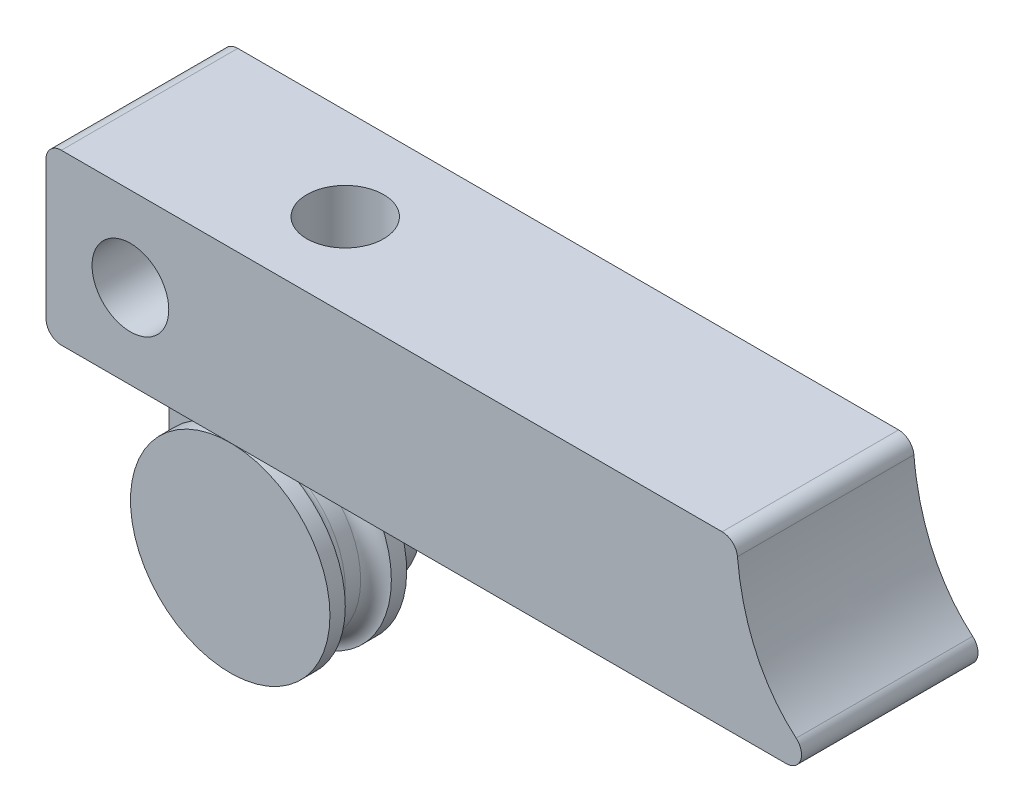
from build123d import *

# Parameters (mm, degrees)
BOSS_EXTRUDE1_DEPTH = 3.5
BOSS_EXTRUDE2_DEPTH = 8
FILLET1_R           = 1
SKETCH3_R           = 1.5
CUT_EXTRUDE1_DEPTH  = 8
SKETCH4_R           = 2.5
CUT_EXTRUDE2_DEPTH  = 5
CUT_EXTRUDE3_REACH  = 58.527
SKETCH5_R           = 1.5
SKETCH6_R           = 2.5
CUT_EXTRUDE4_DEPTH  = 5
CUT_EXTRUDE5_REACH  = 57.139
SKETCH7_R           = 1.5
SKETCH8_R           = 6.5
BOSS_EXTRUDE3_DEPTH = 5
CUT_EXTRUDE6_START  = -4
SKETCH9_R           = 6.5
SKETCH9_R_2         = 5.5
CUT_EXTRUDE6_DEPTH  = 3
FILLET2_R           = 1


with BuildPart() as part:
    # Sketch1 → Boss-Extrude1 (new body)
    with BuildSketch(Plane.XY):
        with BuildLine():
            Line((0, 0), (45, 0))
            add(Edge.make_bspline(
                [(45, 0), (45.167594828, -4.342902355), (46.894946491, -9.232868563), (52, -11)],
                knots=[0, 0, 0, 0, 1, 1, 1, 1], degree=3))
            Line((52, -11), (13, -11))
            Line((13, -11), (13, -20.5))
            ThreePointArc((13, -20.5), (6.5, -27), (0, -20.5))
            Line((0, -20.5), (0, 0))
        make_face()
    extrude(amount=BOSS_EXTRUDE1_DEPTH)

    # Sketch2 → Boss-Extrude2 (add)
    with BuildSketch(Plane.XY.offset(3.5)):
        with BuildLine():
            Line((0, 0), (0, -11))
            Line((0, -11), (13, -11))
            Line((13, -11), (52, -11))
            add(Edge.make_bspline(
                [(52, -11), (46.894946491, -9.232868563), (45.167594828, -4.342902355), (45, 0)],
                knots=[0, 0, 0, 0, 1, 1, 1, 1], degree=3))
            Line((45, 0), (0, 0))
        make_face()
    extrude(amount=BOSS_EXTRUDE2_DEPTH)

    # Fillet1
    fillet1_edges = [part.edges().sort_by_distance(p)[0] for p in [
        (52, -11, 7.5),
        (45, 0, 7.5),
        (0, 0, 5.75),
        (0, -11, 7.5),
    ]]
    fillet(fillet1_edges, radius=FILLET1_R)

    # Sketch3 → Cut-Extrude1 (cut)
    with BuildSketch(Plane.XY.offset(3.5)):
        with Locations((9.004616649, -20.5)):
            Circle(SKETCH3_R)
    extrude(amount=-CUT_EXTRUDE1_DEPTH, mode=Mode.SUBTRACT)

    # Sketch4 → Cut-Extrude2 (cut)
    with BuildSketch(Plane.XY.offset(11.5)):
        with Locations((5.5, -5.5)):
            Circle(SKETCH4_R)
    extrude(amount=-CUT_EXTRUDE2_DEPTH, mode=Mode.SUBTRACT)

    # Sketch5 → Cut-Extrude3 (cut, up to next)
    with BuildSketch(Plane.XY.offset(6.5), mode=Mode.PRIVATE) as cut_extrude3_sk1:
        with Locations((5.5, -5.5)):
            Circle(SKETCH5_R)
    cut_extrude3_tool1 = extrude(cut_extrude3_sk1.sketch, amount=-CUT_EXTRUDE3_REACH, mode=Mode.PRIVATE) & part.part
    add(cut_extrude3_tool1.solids().sort_by_distance((5.5, -5.5, 6.5))[0], mode=Mode.SUBTRACT)

    # Sketch6 → Cut-Extrude4 (cut)
    with BuildSketch(Plane(origin=(0, 0, 0), x_dir=(1, 0, 0), z_dir=(0, 1, 0))):
        with Locations(Location((14, -6, 0), (0, 0, 270))):
            Circle(SKETCH6_R)
    extrude(amount=-CUT_EXTRUDE4_DEPTH, mode=Mode.SUBTRACT)

    # Sketch7 → Cut-Extrude5 (cut, up to next)
    with BuildSketch(Plane(origin=(0, -5, 0), x_dir=(1, 0, 0), z_dir=(0, 1, 0)), mode=Mode.PRIVATE) as cut_extrude5_sk1:
        with Locations(Location((14, -6, 0), (0, 0, 270))):
            Circle(SKETCH7_R)
    cut_extrude5_tool1 = extrude(cut_extrude5_sk1.sketch, amount=-CUT_EXTRUDE5_REACH, mode=Mode.PRIVATE) & part.part
    add(cut_extrude5_tool1.solids().sort_by_distance((14, -5, 6))[0], mode=Mode.SUBTRACT)

    # Sketch8 → Boss-Extrude3 (add)
    with BuildSketch(Plane.XY.offset(3.5)):
        with Locations(Location((9.004616649, -20.5, 0), (0, 0, 258.891775774))):
            Circle(SKETCH8_R)
    extrude(amount=BOSS_EXTRUDE3_DEPTH)

    # Sketch9 → Cut-Extrude6 (cut)
    with BuildSketch(Plane.XY.offset(8.5).offset(CUT_EXTRUDE6_START)):
        with Locations(Location((9.004616649, -20.5, 0), (0, 0, 258.891775774))):
            Circle(SKETCH9_R)
        with Locations((9.004616649, -20.5)):
            Circle(SKETCH9_R_2, mode=Mode.SUBTRACT)
    extrude(amount=CUT_EXTRUDE6_DEPTH, mode=Mode.SUBTRACT)

    # Fillet2
    fillet2_edges = [part.edges().sort_by_distance(p)[0] for p in [
        (3.504616649, -20.5, 4.5),
        (3.504616649, -20.5, 7.5),
    ]]
    fillet(fillet2_edges, radius=FILLET2_R - 0.0001)  # a hair under: the kernel refuses the full size


solid = part.part
